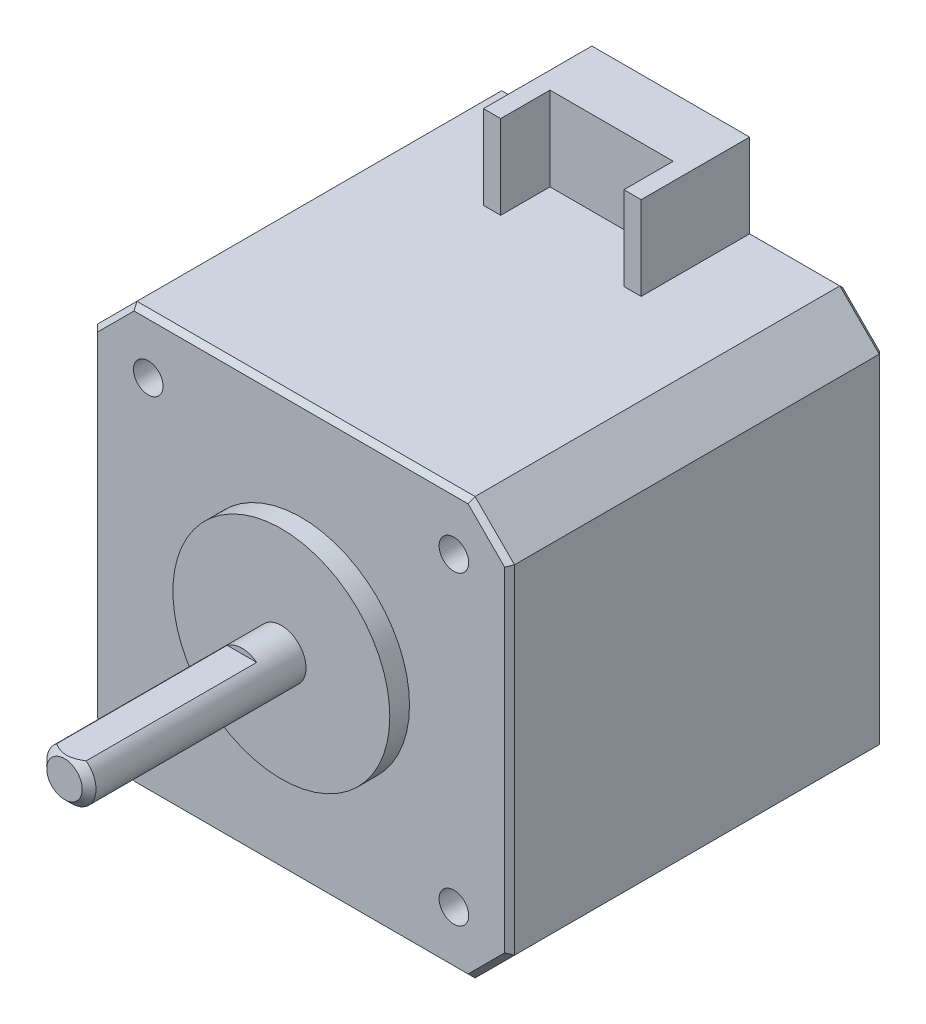
from build123d import *

# Parameters (mm, degrees)
SKETCH1_W           = 42.3
SKETCH1_H           = 42.3
BOSS_EXTRUDE1_DEPTH = 38
SKETCH2_R           = 11
SKETCH2_R_2         = 2.5
BOSS_EXTRUDE2_DEPTH = 2
SKETCH2_3_R         = 2.5
BOSS_EXTRUDE3_DEPTH = 24
SKETCH3_R           = 1.5
CUT_EXTRUDE1_DEPTH  = 5
CHAMFER1_SIZE       = 4
CHAMFER2_SIZE       = 0.7
SKETCH4_R           = 8
SKETCH4_R_2         = 2.5
CUT_EXTRUDE2_DEPTH  = 0.5
CHAMFER3_SIZE       = 0.3
CHAMFER4_SIZE       = 0.5
SKETCH5_R           = 3
CUT_EXTRUDE3_DEPTH  = 0.5
CUT_EXTRUDE4_DEPTH  = 2
CHAMFER5_SIZE       = 0.3
CUT_EXTRUDE5_START  = -18
CUT_EXTRUDE5_DEPTH  = 18
BOSS_EXTRUDE5_DEPTH = 8.5


with BuildPart() as part:
    # Sketch1 → Boss-Extrude1 (new body)
    with BuildSketch(Plane.XY):
        Rectangle(SKETCH1_W, SKETCH1_H)
    extrude(amount=BOSS_EXTRUDE1_DEPTH)

    # Sketch2 → Boss-Extrude2 (add)
    with BuildSketch(Plane.XY.offset(38)):
        Circle(SKETCH2_R)
        Circle(SKETCH2_R_2, mode=Mode.SUBTRACT)
    extrude(amount=BOSS_EXTRUDE2_DEPTH)

    # Sketch2<3> → Boss-Extrude3 (add)
    with BuildSketch(Plane.XY.offset(38)):
        Circle(SKETCH2_3_R)
    extrude(amount=BOSS_EXTRUDE3_DEPTH)

    # Sketch3 → Cut-Extrude1 (cut)
    with BuildSketch(Plane.XY.offset(38)):
        with Locations((-15.5, -15.5)):
            Circle(SKETCH3_R)
        with Locations((15.5, -15.5)):
            Circle(SKETCH3_R)
        with Locations((15.5, 15.5)):
            Circle(SKETCH3_R)
        with Locations((-15.5, 15.5)):
            Circle(SKETCH3_R)
    extrude(amount=-CUT_EXTRUDE1_DEPTH, mode=Mode.SUBTRACT)

    # Chamfer1
    chamfer1_edges = [part.edges().sort_by_distance(p)[0] for p in [
        (-21.15, 21.15, 19),
        (21.15, 21.15, 19),
        (21.15, -21.15, 19),
        (-21.15, -21.15, 19),
    ]]
    chamfer(chamfer1_edges, length=CHAMFER1_SIZE)

    # Chamfer2
    chamfer2_edges = [part.edges().sort_by_distance(p)[0] for p in [
        (-2.5, 0, 62),
    ]]
    chamfer(chamfer2_edges, length=CHAMFER2_SIZE)

    # Sketch4 → Cut-Extrude2 (cut)
    with BuildSketch(Plane(origin=(0, 0, 0), x_dir=(-1, 0, 0), z_dir=(0, 0, -1))):
        Circle(SKETCH4_R)
        Circle(SKETCH4_R_2, mode=Mode.SUBTRACT)
    extrude(amount=-CUT_EXTRUDE2_DEPTH, mode=Mode.SUBTRACT)

    # Chamfer3
    chamfer3_edges = [part.edges().sort_by_distance(p)[0] for p in [
        (2.5, 0, 0),
    ]]
    chamfer(chamfer3_edges, length=CHAMFER3_SIZE)

    # Chamfer4
    chamfer4_edges = [part.edges().sort_by_distance(p)[0] for p in [
        (0, 21.15, 38),
        (-19.15, 19.15, 38),
        (-21.15, 0, 38),
        (21.15, 0, 38),
        (19.15, -19.15, 38),
        (0, -21.15, 38),
        (-19.15, -19.15, 38),
        (19.15, 19.15, 0),
        (21.15, 0, 0),
        (19.15, -19.15, 0),
        (0, -21.15, 0),
        (-19.15, -19.15, 0),
        (-21.15, 0, 0),
        (-19.15, 19.15, 0),
        (0, 21.15, 0),
        (19.15, 19.15, 38),
    ]]
    chamfer(chamfer4_edges, length=CHAMFER4_SIZE)

    # Sketch5 → Cut-Extrude3 (cut)
    # profile 1 of 4: a face of its own
    with BuildSketch(Plane(origin=(0, 0, 0), x_dir=(-1, 0, 0), z_dir=(0, 0, -1))):
        with Locations((-15.5, 15.5)):
            Circle(SKETCH5_R)
        Polygon((-15.5, 17.232050808), (-14, 16.366025404), (-14, 14.633974596), (-15.5, 13.767949192), (-17, 14.633974596), (-17, 16.366025404), align=None, mode=Mode.SUBTRACT)
    # profile 2 of 4: a face of its own
    with BuildSketch(Plane(origin=(0, 0, 0), x_dir=(-1, 0, 0), z_dir=(0, 0, -1))):
        with Locations((15.5, 15.5)):
            Circle(SKETCH5_R)
        Polygon((15.5, 17.232050808), (17, 16.366025404), (17, 14.633974596), (15.5, 13.767949192), (14, 14.633974596), (14, 16.366025404), align=None, mode=Mode.SUBTRACT)
    # profile 3 of 4: a face of its own
    with BuildSketch(Plane(origin=(0, 0, 0), x_dir=(-1, 0, 0), z_dir=(0, 0, -1))):
        with Locations((15.5, -15.5)):
            Circle(SKETCH5_R)
        Polygon((17, -14.633974596), (17, -16.366025404), (15.5, -17.232050808), (14, -16.366025404), (14, -14.633974596), (15.5, -13.767949192), align=None, mode=Mode.SUBTRACT)
    # profile 4 of 4: a face of its own
    with BuildSketch(Plane(origin=(0, 0, 0), x_dir=(-1, 0, 0), z_dir=(0, 0, -1))):
        with Locations((-15.5, -15.5)):
            Circle(SKETCH5_R)
        Polygon((-15.5, -13.767949192), (-14, -14.633974596), (-14, -16.366025404), (-15.5, -17.232050808), (-17, -16.366025404), (-17, -14.633974596), align=None, mode=Mode.SUBTRACT)
    extrude(amount=-CUT_EXTRUDE3_DEPTH, mode=Mode.SUBTRACT)

    # Sketch5<3> → Cut-Extrude4 (cut)
    with BuildSketch(Plane(origin=(0, 0, 0), x_dir=(-1, 0, 0), z_dir=(0, 0, -1))):
        Polygon((-14, 14.633974596), (-14, 16.366025404), (-15.5, 17.232050808), (-17, 16.366025404), (-17, 14.633974596), (-15.5, 13.767949192), align=None)
        Polygon((17, 14.633974596), (17, 16.366025404), (15.5, 17.232050808), (14, 16.366025404), (14, 14.633974596), (15.5, 13.767949192), align=None)
        Polygon((15.5, -17.232050808), (17, -16.366025404), (17, -14.633974596), (15.5, -13.767949192), (14, -14.633974596), (14, -16.366025404), align=None)
        Polygon((-14, -16.366025404), (-14, -14.633974596), (-15.5, -13.767949192), (-17, -14.633974596), (-17, -16.366025404), (-15.5, -17.232050808), align=None)
    extrude(amount=-CUT_EXTRUDE4_DEPTH, mode=Mode.SUBTRACT)

    # Chamfer5
    chamfer5_edges = [part.edges().sort_by_distance(p)[0] for p in [
        (18.5, -15.5, 0),
        (18.5, 15.5, 0),
        (-12.5, 15.5, 0),
        (-12.5, -15.5, 0),
    ]]
    chamfer(chamfer5_edges, length=CHAMFER5_SIZE)

    # Sketch6 → Cut-Extrude5 (cut)
    with BuildSketch(Plane.XY.offset(62).offset(CUT_EXTRUDE5_START)):
        with BuildLine():
            ThreePointArc((1.5, 2), (0, 2.5), (-1.5, 2))
            Line((-1.5, 2), (1.5, 2))
        make_face()
    extrude(amount=CUT_EXTRUDE5_DEPTH, mode=Mode.SUBTRACT)

    # Sketch7 → Boss-Extrude5 (add)
    with BuildSketch(Plane(origin=(0, 21.15, 0), x_dir=(1, 0, 0), z_dir=(0, 1, 0))):
        Polygon((8, -0.5), (-8, -0.5), (-8, -11.5), (-6.25, -11.5), (-6.25, -6.5), (6.25, -6.5), (6.25, -11.5), (8, -11.5), align=None)
    extrude(amount=BOSS_EXTRUDE5_DEPTH)


solid = part.part
